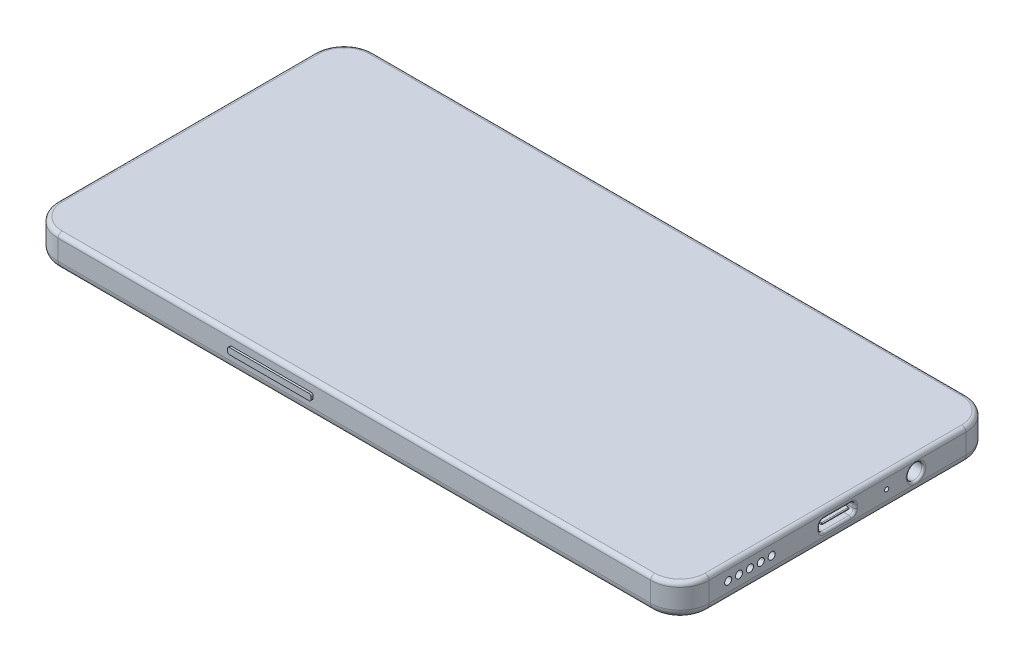
from build123d import *

# Parameters (mm, degrees)
SKETCH1_W                = 155.7
SKETCH1_H                = 75.4
BOSS_EXTRUDE1_DEPTH      = 7.75
FILLET1_R                = 7
FILLET2_R                = 1
FILLET3_R                = 2
BOSS_EXTRUDE2_DEPTH      = 0.6
SKETCH3_R                = 4
CUT_EXTRUDE1_DEPTH       = 0.1
SKETCH4_R                = 2
CUT_EXTRUDE2_DEPTH       = 0.1
CUT_EXTRUDE3_DEPTH       = 0.1
SKETCH6_W                = 6.840301521
SKETCH6_H                = 12.5
CUT_EXTRUDE4_DEPTH       = 0.1
FILLET4_R                = 2
FILLET5_R                = 0.5
BOSS_EXTRUDE3_DEPTH      = 0.2
BOSS_EXTRUDE3_DEPTH_BACK = 0.2
SKETCH7_W                = 12
SKETCH7_H                = 2
FILLET6_R                = 1
CUT_EXTRUDE5_DEPTH       = 0.5
BOSS_EXTRUDE4_DEPTH      = 0.6
FILLET7_R                = 0.1
SKETCH11_W               = 8.5
SKETCH11_H               = 2.75
CUT_EXTRUDE6_DEPTH       = 6.5
FILLET8_R                = 1
SKETCH12_W               = 6.5
SKETCH12_H               = 0.4
BOSS_EXTRUDE5_DEPTH      = 6
FILLET9_R                = 0.5
SKETCH13_R               = 0.85
CUT_EXTRUDE7_DEPTH       = 6
SKETCH14_R               = 1.85
CUT_EXTRUDE8_DEPTH       = 14
FILLET10_R               = 0.5
FILLET12_R               = 0.2
SKETCH15_R               = 0.5
CUT_EXTRUDE9_DEPTH       = 6
SKETCH16_R               = 0.5
CUT_EXTRUDE10_DEPTH      = 6
SKETCH18_W               = 20
SKETCH18_H               = 1.5
BOSS_EXTRUDE6_DEPTH      = 0.5
FILLET14_R               = 0.5


# Some blends are built 0.0001 mm under size
with BuildPart() as part:
    # Sketch1 → Boss-Extrude1 (new body)
    with BuildSketch(Plane(origin=(0, 0, 0), x_dir=(1, 0, 0), z_dir=(0, 1, 0))):
        Rectangle(SKETCH1_W, SKETCH1_H)
    extrude(amount=BOSS_EXTRUDE1_DEPTH)

    # Fillet1
    fillet1_edges = [part.edges().sort_by_distance(p)[0] for p in [
        (77.85, 3.875, 37.7),
        (-77.85, 3.875, 37.7),
        (-77.85, 3.875, -37.7),
        (77.85, 3.875, -37.7),
    ]]
    fillet(fillet1_edges, radius=FILLET1_R)

    # Fillet2
    fillet2_edges = [part.edges().sort_by_distance(p)[0] for p in [
        (-77.85, 7.75, 0),
        (0, 7.75, -37.7),
        (77.85, 7.75, 0),
        (0, 7.75, 37.7),
        (-75.799747468, 7.75, 35.649747468),
        (75.799747468, 7.75, 35.649747468),
        (75.799747468, 7.75, -35.649747468),
        (-75.799747468, 7.75, -35.649747468),
    ]]
    fillet(fillet2_edges, radius=FILLET2_R)

    # Fillet3
    fillet3_edges = [part.edges().sort_by_distance(p)[0] for p in [
        (-77.85, 0, 0),
        (77.85, 0, 0),
        (0, 0, 37.7),
        (0, 0, -37.7),
        (-75.799747468, 0, 35.649747468),
        (75.799747468, 0, 35.649747468),
        (75.799747468, 0, -35.649747468),
        (-75.799747468, 0, -35.649747468),
    ]]
    fillet(fillet3_edges, radius=FILLET3_R)

    # Sketch2 → Boss-Extrude2 (add)
    with BuildSketch(Plane.XZ):
        with BuildLine():
            Line((-49.85, -5.575), (-59.85, -5.575))
            ThreePointArc((-59.85, -5.575), (-65.425, 0), (-59.85, 5.575))
            Line((-59.85, 5.575), (-49.85, 5.575))
            ThreePointArc((-49.85, 5.575), (-44.275, 0), (-49.85, -5.575))
        make_face()
    extrude(amount=BOSS_EXTRUDE2_DEPTH)

    # Sketch3 → Cut-Extrude1 (cut)
    with BuildSketch(Plane.XZ.offset(0.6)):
        with Locations(Location((-49.86189839, 0.010581739, 0), (0, 0, 270))):
            Circle(SKETCH3_R)
        with Locations(Location((-59.86189839, 0, 0), (0, 0, 270))):
            Circle(SKETCH3_R)
    extrude(amount=-CUT_EXTRUDE1_DEPTH, mode=Mode.SUBTRACT)

    # Sketch4 → Cut-Extrude2 (cut)
    with BuildSketch(Plane.XZ.offset(0.5)):
        with Locations(Location((-49.86189839, 0.010581739, 0), (0, 0, 270))):
            Circle(SKETCH4_R)
        with Locations(Location((-59.86189839, 0, 0), (0, 0, 270))):
            Circle(SKETCH4_R)
    extrude(amount=-CUT_EXTRUDE2_DEPTH, mode=Mode.SUBTRACT)

    # Sketch5 → Cut-Extrude3 (cut)
    with BuildSketch(Plane.XZ):
        with BuildLine():
            Line((-41.11189839, -2.647579151), (-41.11189839, 2.647579151))
            ThreePointArc((-41.11189839, 2.647579151), (-39.86189839, 3.897579151), (-38.61189839, 2.647579151))
            Line((-38.61189839, 2.647579151), (-38.61189839, -2.647579151))
            ThreePointArc((-38.61189839, -2.647579151), (-39.86189839, -3.897579151), (-41.11189839, -2.647579151))
        make_face()
    extrude(amount=-CUT_EXTRUDE3_DEPTH, mode=Mode.SUBTRACT)

    # Sketch6 → Cut-Extrude4 (cut)
    with BuildSketch(Plane.XZ):
        with Locations((-32.69174763, 0)):
            Rectangle(SKETCH6_W, SKETCH6_H)
    extrude(amount=-CUT_EXTRUDE4_DEPTH, mode=Mode.SUBTRACT)

    # Fillet4
    fillet4_edges = [part.edges().sort_by_distance(p)[0] for p in [
        (-36.11189839, 0.05, -6.25),
        (-36.11189839, 0.05, 6.25),
        (-29.271596869, 0.05, 6.25),
        (-29.271596869, 0.05, -6.25),
    ]]
    fillet(fillet4_edges, radius=FILLET4_R)

    # Fillet5
    # the kernel refuses this fillet: 0.5 mm, written as the material it adds along each edge
    with BuildSketch(Plane(origin=(-34.11189839, 0.1, 4.25), x_dir=(-1, 0, 0), z_dir=(0, 0, -1))) as fillet5_piece_1:
        with BuildLine():
            CenterArc((1.7, -0.5), FILLET5_R, 53.130102354, 36.869897646)
            Line((1.7, 0), (1.7, 0.01))
            Line((1.7, 0.01), (2, 0.01))
            Line((2, 0.01), (2.01, 0))
            ThreePointArc((2.01, 0), (2.01, -0.05), (2.006, -0.092))
            Line((2.006, -0.092), (2, -0.1))
        make_face()
    revolve(axis=Axis((-34.11189839, 0.1, 4.25), (0, 1, 0)), revolution_arc=90)
    with BuildSketch(Plane(origin=(-34.11189839, 0.1, 6.25), x_dir=(0, -1, 0), z_dir=(1, 0, 0)), Plane(origin=(-31.271596869, 0.1, -6.25), x_dir=(0, -1, 0), z_dir=(-1, 0, 0))) as fillet5_piece_2:
        with BuildLine():
            CenterArc((0.5, 0.3), FILLET5_R, 180, 36.869897646)
            Line((0, 0.3), (-0.01, 0.3))
            Line((-0.01, 0.3), (-0.01, 0))
            Line((-0.01, 0), (0, -0.01))
            ThreePointArc((0, -0.01), (0.05, -0.01), (0.092, -0.006))
            Line((0.092, -0.006), (0.1, 0))
        make_face()
    extrude(amount=2.84030152)
    with BuildSketch(Plane(origin=(-31.271596869, 0.1, 4.25), x_dir=(0, 0, 1), z_dir=(-1, 0, 0))) as fillet5_piece_3:
        with BuildLine():
            CenterArc((1.7, -0.5), FILLET5_R, 53.130102354, 36.869897646)
            Line((1.7, 0), (1.7, 0.01))
            Line((1.7, 0.01), (2, 0.01))
            Line((2, 0.01), (2.01, 0))
            ThreePointArc((2.01, 0), (2.01, -0.05), (2.006, -0.092))
            Line((2.006, -0.092), (2, -0.1))
        make_face()
    revolve(axis=Axis((-31.271596869, 0.1, 4.25), (0, 1, 0)), revolution_arc=90)
    with BuildSketch(Plane(origin=(-29.271596869, 0.1, 4.25), x_dir=(0, -1, 0), z_dir=(0, 0, -1)), Plane(origin=(-36.11189839, 0.1, -4.25), x_dir=(0, -1, 0), z_dir=(0, 0, 1))) as fillet5_piece_4:
        with BuildLine():
            CenterArc((0.5, 0.3), FILLET5_R, 180, 36.869897646)
            Line((0, 0.3), (-0.01, 0.3))
            Line((-0.01, 0.3), (-0.01, 0))
            Line((-0.01, 0), (0, -0.01))
            ThreePointArc((0, -0.01), (0.05, -0.01), (0.092, -0.006))
            Line((0.092, -0.006), (0.1, 0))
        make_face()
    extrude(amount=8.5)
    with BuildSketch(Plane(origin=(-31.271596869, 0.1, -4.25), x_dir=(0, 0, -1), z_dir=(-1, 0, 0))) as fillet5_piece_5:
        with BuildLine():
            CenterArc((1.7, 0.5), FILLET5_R, 270, 36.869897646)
            Line((1.7, 0), (1.7, -0.01))
            Line((1.7, -0.01), (2, -0.01))
            Line((2, -0.01), (2.01, 0))
            ThreePointArc((2.01, 0), (2.01, 0.05), (2.006, 0.092))
            Line((2.006, 0.092), (2, 0.1))
        make_face()
    revolve(axis=Axis((-31.271596869, 0.1, -4.25), (0, -1, 0)), revolution_arc=90)
    with BuildSketch(Plane(origin=(-34.11189839, 0.1, -4.25), x_dir=(0, 0, -1), z_dir=(1, 0, 0))) as fillet5_piece_6:
        with BuildLine():
            CenterArc((1.7, -0.5), FILLET5_R, 53.130102354, 36.869897646)
            Line((1.7, 0), (1.7, 0.01))
            Line((1.7, 0.01), (2, 0.01))
            Line((2, 0.01), (2.01, 0))
            ThreePointArc((2.01, 0), (2.01, -0.05), (2.006, -0.092))
            Line((2.006, -0.092), (2, -0.1))
        make_face()
    revolve(axis=Axis((-34.11189839, 0.1, -4.25), (0, 1, 0)), revolution_arc=90)

    # Sketch7 → Boss-Extrude3 (add, two sides: drawn at the far end of the back side and taken through both)
    with BuildSketch(Plane.XY.offset(-37.7).offset(-BOSS_EXTRUDE3_DEPTH_BACK)):
        with Locations((-23.85, 4.375)):
            Rectangle(SKETCH7_W, SKETCH7_H)
    extrude(amount=BOSS_EXTRUDE3_DEPTH + BOSS_EXTRUDE3_DEPTH_BACK)

    # Fillet6
    fillet6_edges = [part.edges().sort_by_distance(p)[0] for p in [
        (-17.85, 3.375, -37.8),
        (-17.85, 5.375, -37.8),
        (-29.85, 3.375, -37.8),
        (-29.85, 5.375, -37.8),
    ]]
    fillet(fillet6_edges, radius=FILLET6_R - 0.0001)  # a hair under: the kernel refuses the full size

    # Sketch8 → Cut-Extrude5 (cut)
    with BuildSketch(Plane(origin=(0, 0, -37.7), x_dir=(-1, 0, 0), z_dir=(0, 0, -1))):
        with BuildLine():
            Line((48.114993193, 3.475), (39.114993193, 3.475))
            ThreePointArc((39.114993193, 3.475), (38.214993193, 4.375), (39.114993193, 5.275))
            Line((39.114993193, 5.275), (48.114993193, 5.275))
            ThreePointArc((48.114993193, 5.275), (49.014993193, 4.375), (48.114993193, 3.475))
        make_face()
    extrude(amount=-CUT_EXTRUDE5_DEPTH, mode=Mode.SUBTRACT)

    # Sketch9 → Boss-Extrude4 (add)
    with BuildSketch(Plane(origin=(0, 0, -37.2), x_dir=(-1, 0, 0), z_dir=(0, 0, -1))):
        with BuildLine():
            Line((47.918302414, 3.475), (39.518302414, 3.475))
            ThreePointArc((39.518302414, 3.475), (38.618302414, 4.375), (39.518302414, 5.275))
            Line((39.518302414, 5.275), (47.918302414, 5.275))
            ThreePointArc((47.918302414, 5.275), (48.818302414, 4.375), (47.918302414, 3.475))
        make_face()
    extrude(amount=BOSS_EXTRUDE4_DEPTH)

    # Fillet7
    fillet7_edges = [part.edges().sort_by_distance(p)[0] for p in [
        (-43.718302414, 3.475, -37.8),
        (-38.618302414, 4.375, -37.8),
        (-43.718302414, 5.275, -37.8),
        (-48.818302414, 4.375, -37.8),
    ]]
    fillet(fillet7_edges, radius=FILLET7_R - 0.0001)  # a hair under: the kernel refuses the full size

    # Sketch11 → Cut-Extrude6 (cut)
    with BuildSketch(Plane(origin=(77.85, 0, 0), x_dir=(0, 0, -1), z_dir=(1, 0, 0))):
        with Locations((0, 4.375)):
            Rectangle(SKETCH11_W, SKETCH11_H)
    extrude(amount=-CUT_EXTRUDE6_DEPTH, mode=Mode.SUBTRACT)

    # Fillet8
    fillet8_edges = [part.edges().sort_by_distance(p)[0] for p in [
        (74.6, 3, 4.25),
        (74.6, 5.75, 4.25),
        (74.6, 5.75, -4.25),
        (74.6, 3, -4.25),
    ]]
    fillet(fillet8_edges, radius=FILLET8_R)

    # Sketch12 → Boss-Extrude5 (add)
    with BuildSketch(Plane(origin=(71.35, 0, 0), x_dir=(0, 0, -1), z_dir=(1, 0, 0))):
        with Locations((0.072516481, 4.375)):
            Rectangle(SKETCH12_W, SKETCH12_H)
    extrude(amount=BOSS_EXTRUDE5_DEPTH)

    # Fillet9
    fillet9_edges = [part.edges().sort_by_distance(p)[0] for p in [
        (77.85, 4.375, 4.25),
        (77.85, 5.75, 0),
        (77.85, 4.375, -4.25),
        (77.85, 3, 0),
        (77.85, 5.457106781, 3.957106781),
        (77.85, 5.457106781, -3.957106781),
        (77.85, 3.292893219, 3.957106781),
        (77.85, 3.292893219, -3.957106781),
    ]]
    fillet(fillet9_edges, radius=FILLET9_R)

    # Sketch13 → Cut-Extrude7 (cut)
    with BuildSketch(Plane(origin=(77.85, 0, 0), x_dir=(0, 0, -1), z_dir=(1, 0, 0))):
        with Locations((-15.75, 4.375)):
            Circle(SKETCH13_R)
        with Locations((-18.35, 4.375)):
            Circle(SKETCH13_R)
        with Locations((-20.95, 4.375)):
            Circle(SKETCH13_R)
        with Locations((-23.55, 4.375)):
            Circle(SKETCH13_R)
        with Locations((-26.15, 4.375)):
            Circle(SKETCH13_R)
    extrude(amount=-CUT_EXTRUDE7_DEPTH, mode=Mode.SUBTRACT)

    # Sketch14 → Cut-Extrude8 (cut)
    with BuildSketch(Plane(origin=(77.85, 0, 0), x_dir=(0, 0, -1), z_dir=(1, 0, 0))):
        with Locations((18.75, 4.375)):
            Circle(SKETCH14_R)
    extrude(amount=-CUT_EXTRUDE8_DEPTH, mode=Mode.SUBTRACT)

    # Fillet10
    fillet10_edges = [part.edges().sort_by_distance(p)[0] for p in [
        (77.85, 4.375, -16.9),
    ]]
    fillet(fillet10_edges, radius=FILLET10_R)

    # Fillet12
    fillet12_edges = [part.edges().sort_by_distance(p)[0] for p in [
        (77.35, 4.375, 3.177483519),
        (77.35, 4.175, -0.072516481),
        (77.35, 4.375, -3.322516481),
        (77.35, 4.575, -0.072516481),
    ]]
    fillet(fillet12_edges, radius=FILLET12_R - 0.0001)  # a hair under: the kernel refuses the full size

    # Sketch15 → Cut-Extrude9 (cut)
    with BuildSketch(Plane(origin=(77.85, 0, 0), x_dir=(0, 0, -1), z_dir=(1, 0, 0))):
        with Locations((11.75, 4.375)):
            Circle(SKETCH15_R)
    extrude(amount=-CUT_EXTRUDE9_DEPTH, mode=Mode.SUBTRACT)

    # Sketch16 → Cut-Extrude10 (cut)
    with BuildSketch(Plane.ZY.offset(77.85)):
        with Locations((-16.7, 4.375)):
            Circle(SKETCH16_R)
    extrude(amount=-CUT_EXTRUDE10_DEPTH, mode=Mode.SUBTRACT)

    # Sketch18 → Boss-Extrude6 (add)
    with BuildSketch(Plane.XY.offset(37.7)):
        with Locations((-19.85, 4.375)):
            Rectangle(SKETCH18_W, SKETCH18_H)
    extrude(amount=BOSS_EXTRUDE6_DEPTH)

    # Fillet14
    fillet14_edges = [part.edges().sort_by_distance(p)[0] for p in [
        (-9.85, 3.625, 37.95),
        (-9.85, 5.125, 37.95),
        (-29.85, 5.125, 37.95),
        (-29.85, 3.625, 37.95),
    ]]
    fillet(fillet14_edges, radius=FILLET14_R)


solid = part.part
